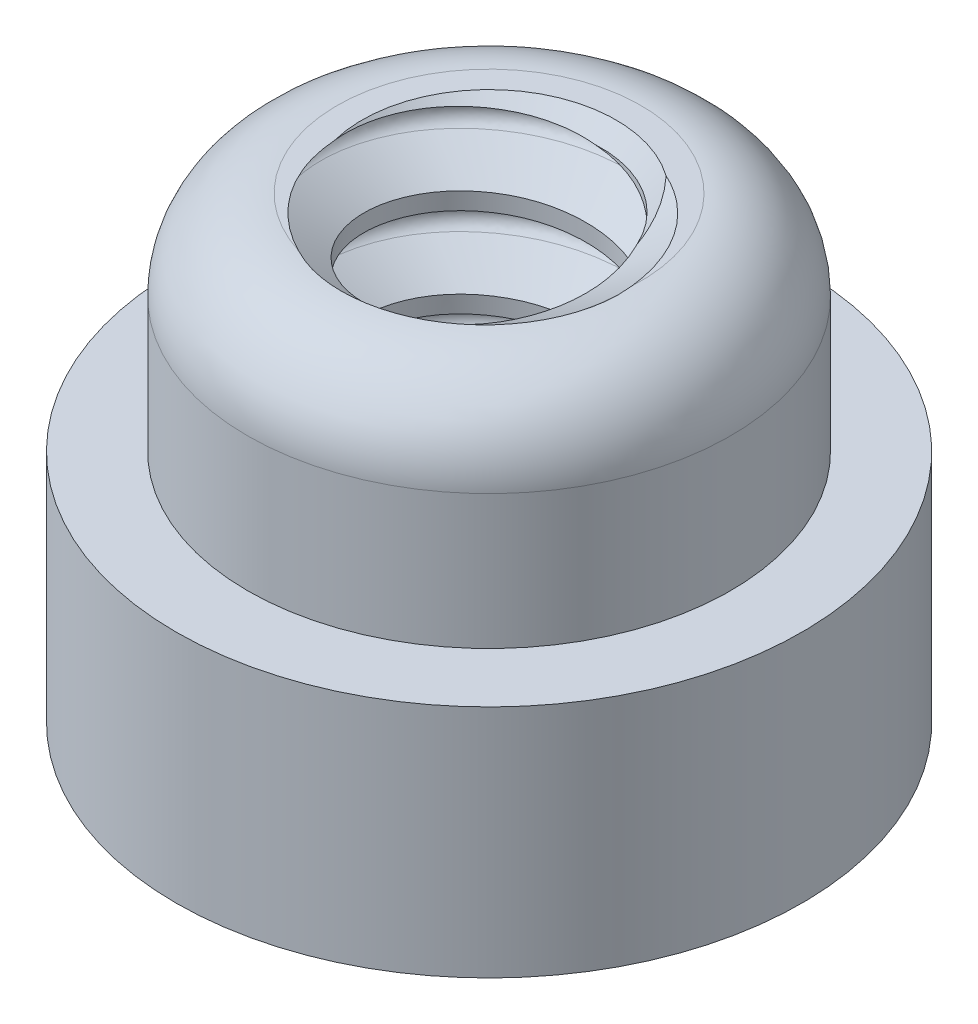
from build123d import *

# Parameters (mm, degrees)
SCHNITT_AUSTRAGUNG2_PITCH = 2


with BuildPart() as part:
    # Skizze1 → Rotation1 (revolve)
    with BuildSketch(Plane.XY, mode=Mode.PRIVATE) as rotation1_sk:
        with BuildLine():
            Line((7, 0), (2.5, 0))
            Line((2.5, 0), (2.5, 10.25))
            Line((2.5, 10.25), (3.4, 10.25))
            ThreePointArc((3.4, 10.25), (4.814213562, 9.664213562), (5.4, 8.25))
            Line((5.4, 8.25), (5.4, 5.25))
            Line((5.4, 5.25), (7, 5.25))
            Line((7, 5.25), (7, 0))
        make_face()
    revolve(rotation1_sk.sketch.rotate(Axis((0, 12.455425303, 0), (0, -1, 0)), 90), axis=Axis((0, 12.455425303, 0), (0, -1, 0)))

    # Schnitt-Austragung2: the profile of Skizze3 profile screwed along a right-hand helix of 8 turns, 10 arcs to a turn; built about Z, then put on its axis
    schnitt_austragung2_z = Axis((0, 0, 0), (0, 0, 1))
    schnitt_austragung2_corners = [(2.4997, 0, -1.616753959), (3.45, 0, -1.068097998), (3.6, 0, -0.808290377), (3.45, 0, -0.548482756), (2.4997, 0, 0.000173205)]
    with BuildLine(mode=Mode.PRIVATE) as schnitt_austragung2_profile:
        Line(schnitt_austragung2_corners[0], schnitt_austragung2_corners[1])
        Line(schnitt_austragung2_corners[3], schnitt_austragung2_corners[4])
        Line(schnitt_austragung2_corners[4], schnitt_austragung2_corners[0])
        ThreePointArc((3.45, 0, -1.068097998), (3.559807621, 0, -0.958290377), (3.6, 0, -0.808290377))
        ThreePointArc((3.6, 0, -0.808290377), (3.559807621, 0, -0.658290377), (3.45, 0, -0.548482756))
    schnitt_austragung2_cap = Face(schnitt_austragung2_profile.wire())
    schnitt_austragung2_arcs = [((3.45, 0, -1.068097998), (3.6, 0, -0.981495458), (3.6, 0, -0.808290377), (1, 0.8660254037844423, 1)), ((3.6, 0, -0.808290377), (3.6, 0, -0.635085296), (3.45, 0, -0.548482756), (1, 0.8660254037844423, 1))]  # start, shoulder, end, weights
    schnitt_austragung2_turn_angles = [0, 18, 36, 54, 72, 90, 108, 126, 144, 162, 180, 198, 216, 234, 252, 270, 288, 306, 324, 342, 360]
    schnitt_austragung2_turn_weights = [1, 0.9510565162951535, 1, 0.9510565162951535, 1, 0.9510565162951535, 1, 0.9510565162951535, 1, 0.9510565162951535, 1, 0.9510565162951535, 1, 0.9510565162951535, 1, 0.9510565162951535, 1, 0.9510565162951535, 1, 0.9510565162951535, 1]
    schnitt_austragung2_turn_rails = [Edge.make_bspline([Vector(p[0], p[1], 0).rotate(schnitt_austragung2_z, schnitt_austragung2_turn_angles[k]) / schnitt_austragung2_turn_weights[k] + Vector(0, 0, p[2] + SCHNITT_AUSTRAGUNG2_PITCH * schnitt_austragung2_turn_angles[k] / 360) for k in range(21)], [0, 0, 0, 1, 1, 2, 2, 3, 3, 4, 4, 5, 5, 6, 6, 7, 7, 8, 8, 9, 9, 10, 10, 10], 2, schnitt_austragung2_turn_weights) for p in schnitt_austragung2_corners]
    schnitt_austragung2_turn_sides = [*[Face.make_surface_from_curves(schnitt_austragung2_turn_rails[p[0]], schnitt_austragung2_turn_rails[p[1]]) for p in [(0, 1), (3, 4), (4, 0)]], *[Face.make_bezier_surface([[Vector(p[j][0], p[j][1], 0).rotate(schnitt_austragung2_z, schnitt_austragung2_turn_angles[2 * i + k]) / schnitt_austragung2_turn_weights[2 * i + k] + Vector(0, 0, p[j][2] + SCHNITT_AUSTRAGUNG2_PITCH * schnitt_austragung2_turn_angles[2 * i + k] / 360) for k in range(3)] for j in range(3)], [[p[3][j] * schnitt_austragung2_turn_weights[2 * i + k] for k in range(3)] for j in range(3)]) for p in schnitt_austragung2_arcs for i in range(10)]]
    schnitt_austragung2 = Plane(origin=(0, 10.25, 0), x_dir=(0, 0, -1), z_dir=(0, -1, 0)) * Solid(Shell([*[p.moved(Location((0, 0, SCHNITT_AUSTRAGUNG2_PITCH * i))) for i in range(8) for p in schnitt_austragung2_turn_sides], schnitt_austragung2_cap, schnitt_austragung2_cap.rotate(schnitt_austragung2_z, 2880).moved(Location((0, 0, SCHNITT_AUSTRAGUNG2_PITCH * 2880 / 360)))]))
    add(schnitt_austragung2, mode=Mode.SUBTRACT)

    # Skizze4 → Schnitt-Rotation1 (revolve, cut)
    with BuildSketch(Plane(origin=(0, 0, 0), x_dir=(0, 0, -1), z_dir=(1, 0, 0))):
        Polygon((3.525741262, 10.987315375), (1.562443818, 8.874995923), (0, 8.874995923), (0, 10.987315375), align=None)
    revolve(axis=Axis((0, 0, 0), (0, 1, 0)), mode=Mode.SUBTRACT)


solid = part.part
